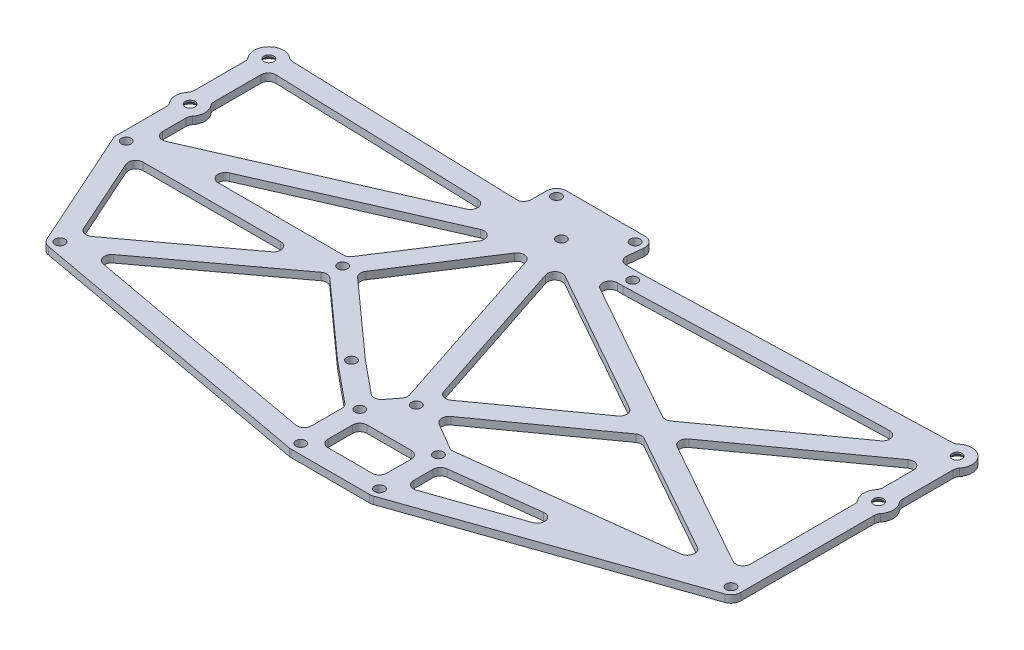
from build123d import *

# Parameters (mm, degrees)
SKETCH1_W               = 296
SKETCH1_H               = 146
SKETCH1_R               = 2
BOSS_EXTRUDE1_DEPTH     = 3
CHAMFER1_SIZE           = 2.3
SKETCH2_R               = 2
CUT_EXTRUDE2_DEPTH      = 3
SKETCH5_W               = 42
SKETCH5_H               = 8
SKETCH5_R               = 2
BOSS_EXTRUDE2_DEPTH     = 3
FILLET1_R               = 4
CUT_EXTRUDE3_DEPTH      = 334.677988486
CUT_EXTRUDE3_DEPTH_BACK = 334.677988486
SKETCH6_W               = 24
SKETCH6_H               = 16
FILLET2_START           = -1
FILLET2_DEPTH           = 5
FILLET2_2_DEPTH         = 3
FILLET3_R               = 3


with BuildPart() as part:
    # Sketch1 → Boss-Extrude1 (new body)
    with BuildSketch(Plane(origin=(0, 0, 0), x_dir=(1, 0, 0), z_dir=(0, 1, 0))):
        with Locations((-148, 73)):
            Rectangle(SKETCH1_W, SKETCH1_H)
        with Locations(Location((-288, 108, 0), (0, 0, 270))):
            Circle(SKETCH1_R, mode=Mode.SUBTRACT)
        with Locations(Location((-288, 140, 0), (0, 0, 270))):
            Circle(SKETCH1_R, mode=Mode.SUBTRACT)
        with Locations(Location((-8, 140, 0), (0, 0, 90))):
            Circle(SKETCH1_R, mode=Mode.SUBTRACT)
        with Locations(Location((-8, 108, 0), (0, 0, 90))):
            Circle(SKETCH1_R, mode=Mode.SUBTRACT)
    extrude(amount=BOSS_EXTRUDE1_DEPTH)

    # Chamfer1
    chamfer1_edges = [part.edges().sort_by_distance(p)[0] for p in [
        (-288, 0, -110),
        (-288, 0, -142),
        (-8, 0, -138),
        (-8, 0, -106),
    ]]
    chamfer(chamfer1_edges, length=CHAMFER1_SIZE)

    # Sketch2 → Cut-Extrude2 (cut)
    with BuildSketch(Plane(origin=(0, 3, 0), x_dir=(1, 0, 0), z_dir=(0, 1, 0))):
        with Locations(Location((-136, 136, 0), (0, 0, 270))):
            Circle(SKETCH2_R)
        with Locations(Location((-136, 48, 0), (0, 0, 270))):
            Circle(SKETCH2_R)
        with Locations(Location((-8, 48, 0), (0, 0, 270))):
            Circle(SKETCH2_R)
        with Locations(Location((-165, 136, 0), (0, 0, 270))):
            Circle(SKETCH2_R)
        with Locations(Location((-165, 50.61, 0), (0, 0, 270))):
            Circle(SKETCH2_R)
        with Locations(Location((-146, 35, 0), (0, 0, 270))):
            Circle(SKETCH2_R)
        with Locations(Location((-114, 35, 0), (0, 0, 270))):
            Circle(SKETCH2_R)
        with Locations(Location((-146, 11, 0), (0, 0, 270))):
            Circle(SKETCH2_R)
        with Locations(Location((-114, 11, 0), (0, 0, 270))):
            Circle(SKETCH2_R)
        with Locations(Location((-288, 82, 0), (0, 0, 270))):
            Circle(SKETCH2_R)
        with Locations(Location((-200, 82, 0), (0, 0, 270))):
            Circle(SKETCH2_R)
        with Locations(Location((-266, 33, 0), (0, 0, 270))):
            Circle(SKETCH2_R)
    extrude(amount=-CUT_EXTRUDE2_DEPTH, mode=Mode.SUBTRACT)

    # Sketch5 → Boss-Extrude2 (add, through all)
    with BuildSketch(Plane.XZ):
        with Locations((-165, -150)):
            Rectangle(SKETCH5_W, SKETCH5_H)
        with Locations(Location((-181, -150, 0), (0, 0, 270))):
            Circle(SKETCH5_R, mode=Mode.SUBTRACT)
        with Locations(Location((-149, -150, 0), (0, 0, 270))):
            Circle(SKETCH5_R, mode=Mode.SUBTRACT)
    extrude(amount=-BOSS_EXTRUDE2_DEPTH)

    # Fillet1
    fillet1_edges = [part.edges().sort_by_distance(p)[0] for p in [
        (-144, 1.5, -146),
        (-186, 1.5, -146),
    ]]
    fillet(fillet1_edges, radius=FILLET1_R)
    fillet1_2_edges = [part.edges().sort_by_distance(p)[0] for p in [
        (-144, 1.5, -154),
        (-186, 1.5, -154),
    ]]
    fillet(fillet1_2_edges, radius=FILLET1_R - 0.0001)  # a hair under: the kernel refuses the full size

    # Sketch6 → Cut-Extrude3 (cut, two sides: drawn at the far end of the back side and taken through both)
    with BuildSketch(Plane.XZ.offset(-CUT_EXTRUDE3_DEPTH_BACK)):
        Polygon((-133.907397883, -54.430072896), (-157.980712263, -127.480130325), (-87.351767692, -87.891932095), align=None)
        Polygon((-20.986134941, -135.592230635), (-80.182789638, -93.044635071), (-149.682702068, -132), (-136, -132), (-135.937515251, -132), (-135.875061066, -132.001951693), align=None)
        Polygon((-150, -15.8), (-256.225795533, -35.274729181), (-200.238623302, -76.840963111), (-167.67068416, -47.632174264), (-167.606181941, -47.574324988), (-167.539235065, -47.519322843), (-150, -33.109456561), align=None)
        Polygon((-194.783240599, -82.69435997), (-166.185335484, -126.816842148), (-140.462014687, -48.759868694), (-146.652169254, -40.712667757), (-162.393818059, -53.645675012), align=None)
        Polygon((-202.174118679, -86), (-268.938394143, -86), (-175.620145484, -126.968987217), align=None)
        with BuildLine():
            Line((-182.751496726, -132.575169862), (-284, -88.124607449))
            Line((-284, -88.124607449), (-284, -103.527864045))
            ThreePointArc((-284, -103.527864045), (-282.522774425, -105.550510257), (-282, -108))
            ThreePointArc((-282, -108), (-282.522774425, -110.449489743), (-284, -112.472135955))
            Line((-284, -112.472135955), (-284, -135.527864045))
            ThreePointArc((-284, -135.527864045), (-283.826878454, -135.68896108), (-283.660239543, -135.856754994))
            Line((-283.660239543, -135.856754994), (-182.751496726, -132.575169862))
        make_face()
        Polygon((-264.389069086, -39.177871329), (-281.819412571, -78), (-212.098038631, -78), align=None)
        with BuildLine():
            Line((-292, -103.527864045), (-292, -82))
            ThreePointArc((-292, -82), (-291.911285756, -81.162238858), (-291.649078134, -80.361638389))
            Line((-291.649078134, -80.361638389), (-269.649078134, -31.361638389))
            ThreePointArc((-269.649078134, -31.361638389), (-268.468411335, -29.852469939), (-266.721311475, -29.06557377))
            Line((-266.721311475, -29.06557377), (-146.721311475, -7.06557377))
            ThreePointArc((-146.721311475, -7.06557377), (-146.362142984, -7.016427174), (-146, -7))
            Line((-146, -7), (-114, -7))
            ThreePointArc((-114, -7), (-113.331483701, -7.056259902), (-112.681772734, -7.223457021))
            Line((-112.681772734, -7.223457021), (-6.681772734, -44.223457021))
            ThreePointArc((-6.681772734, -44.223457021), (-4.738642226, -45.684067042), (-4, -48))
            Line((-4, -48), (-4, -103.527864045))
            ThreePointArc((-4, -103.527864045), (-2.522774425, -105.550510257), (-2, -108))
            ThreePointArc((-2, -108), (-2.522774425, -110.449489743), (-4, -112.472135955))
            Line((-4, -112.472135955), (-4, -135.527864045))
            ThreePointArc((-4, -135.527864045), (-2.522774425, -137.550510257), (-2, -140))
            ThreePointArc((-2, -140), (-3.757359379, -144.242640754), (-8.000000188, -146))
            Line((-8.000000188, -146), (0, -146))
            Line((0, -146), (0, 0))
            Line((0, 0), (-296, 0))
            Line((-296, 0), (-296, -146))
            Line((-296, -146), (-288, -146))
            ThreePointArc((-288, -146), (-293.605034154, -142.140932539), (-292, -135.527864045))
            Line((-292, -135.527864045), (-292, -112.472135955))
            ThreePointArc((-292, -112.472135955), (-294, -108), (-292, -103.527864045))
        make_face()
        with Locations((-130, -23)):
            Rectangle(SKETCH6_W, SKETCH6_H)
        Polygon((-44.511030961, -39.492262445), (-110, -16.632905327), (-110, -31.46059643), align=None)
        Polygon((-128.691096176, -48.3272595), (-79.650414034, -83.575249789), (-20.61135626, -50.48329384), (-113.136448618, -39.135876852), align=None)
        with BuildLine():
            Line((-12, -54.827530051), (-72.48143598, -88.727952766))
            Line((-72.48143598, -88.727952766), (-12, -132.198984876))
            Line((-12, -132.198984876), (-12, -112.472135955))
            ThreePointArc((-12, -112.472135955), (-14, -108), (-12, -103.527864045))
            Line((-12, -103.527864045), (-12, -54.827530051))
        make_face()
        with BuildLine():
            ThreePointArc((-145, -150), (-146.171572875, -152.828427125), (-149, -154))
            Line((-149, -154), (-148, -154))
            ThreePointArc((-148, -154), (-145.171572875, -152.828427125), (-144, -150))
            ThreePointArc((-144, -150), (-142.828427125, -147.171572875), (-140, -146))
            Line((-140, -146), (-8.000000188, -146))
            ThreePointArc((-8.000000188, -146), (-10.534741347, -145.438298107), (-12.594892902, -143.858362245))
            Line((-12.594892902, -143.858362245), (-136.062484749, -140))
            Line((-136.062484749, -140), (-146.048534903, -140))
            Line((-146.048534903, -140), (-145.022763384, -149.573867505))
            ThreePointArc((-145.022763384, -149.573867505), (-145.0056949, -149.786629972), (-145, -150))
        make_face()
        with BuildLine():
            Line((-185, -140.652521088), (-283.400214403, -143.852528061))
            ThreePointArc((-283.400214403, -143.852528061), (-285.461808554, -145.436688715), (-288, -146))
            Line((-288, -146), (-190, -146))
            ThreePointArc((-190, -146), (-187.171572875, -147.171572875), (-186, -150))
            ThreePointArc((-186, -150), (-184.828427125, -152.828427125), (-182, -154))
            Line((-182, -154), (-181, -154))
            ThreePointArc((-181, -154), (-183.828427125, -152.828427125), (-185, -150))
            Line((-185, -150), (-185, -140.652521088))
        make_face()
    extrude(amount=CUT_EXTRUDE3_DEPTH + CUT_EXTRUDE3_DEPTH_BACK, mode=Mode.SUBTRACT)


with BuildPart() as cut_extrude3_kept_piece:
    # of the separate pieces the step leaves, the one the design keeps (cut_extrude3_pieces_kept)
    add(part.part.solids().sort_by_distance((-292, 3, -112.472135955))[0])

    # Fillet2: read off the stored shape, not the designer's step
    # Fillet2 outline → Fillet2 (cut)
    with BuildSketch(Plane(origin=(0, 0, 0), x_dir=(1, 0, 0), z_dir=(0, 1, 0)).offset(FILLET2_START)):
        with BuildLine():
            ThreePointArc((-135.890674556, 132.001463772), (-135.937520968, 132.000365965), (-135.984378813, 132))
            Line((-135.984378813, 132), (-135.937515251, 132))
            Line((-135.937515251, 132), (-135.890674556, 132.001463772))
        make_face()
        with BuildLine():
            Line((-167.606181941, 47.574324988), (-167.555971882, 47.533073461))
            ThreePointArc((-167.555971882, 47.533073461), (-167.605723551, 47.574858919), (-167.654558656, 47.61771199))
            Line((-167.654558656, 47.61771199), (-167.606181941, 47.574324988))
        make_face()
    extrude(amount=FILLET2_DEPTH, mode=Mode.SUBTRACT)

    # Fillet2 2 outline → Fillet2 2 (add)
    with BuildSketch(Plane(origin=(0, 0, 0), x_dir=(1, 0, 0), z_dir=(0, 1, 0))):
        with BuildLine():
            Line((-284, 135.527864045), (-284, 134.469986963))
            ThreePointArc((-284, 134.469986963), (-283.913822114, 135.183878191), (-283.660239543, 135.856754994))
            ThreePointArc((-283.660239543, 135.856754994), (-283.826878454, 135.68896108), (-284, 135.527864045))
        make_face()
        with BuildLine():
            ThreePointArc((-283.333333333, 111.771236166), (-283.828427125, 112.656854249), (-284, 113.656854249))
            Line((-284, 113.656854249), (-284, 112.472135955))
            ThreePointArc((-284, 112.472135955), (-283.652518786, 112.135142935), (-283.333333333, 111.771236166))
        make_face()
        with BuildLine():
            Line((-182.751496726, 132.575169862), (-195.967609843, 133.004962159))
            ThreePointArc((-195.967609843, 133.004962159), (-193.119441456, 130.574862501), (-194.859149084, 127.259615168))
            Line((-194.859149084, 127.259615168), (-182.751496726, 132.575169862))
        make_face()
        with BuildLine():
            ThreePointArc((-284, 102.343145751), (-283.828427125, 103.343145751), (-283.333333333, 104.228763834))
            ThreePointArc((-283.333333333, 104.228763834), (-283.652518786, 103.864857065), (-284, 103.527864045))
            Line((-284, 103.527864045), (-284, 102.343145751))
        make_face()
        with BuildLine():
            Line((-284, 88.124607449), (-279.794029814, 89.971130946))
            ThreePointArc((-279.794029814, 89.971130946), (-282.640440405, 90.206299656), (-284, 92.718063036))
            Line((-284, 92.718063036), (-284, 88.124607449))
        make_face()
        with BuildLine():
            Line((-4, 135.527864045), (-4, 134.343145751))
            ThreePointArc((-4, 134.343145751), (-3.828427125, 135.343145751), (-3.333333333, 136.228763834))
            ThreePointArc((-3.333333333, 136.228763834), (-3.652518786, 135.864857065), (-4, 135.527864045))
        make_face()
        with BuildLine():
            ThreePointArc((-4, 102.343145751), (-3.828427125, 103.343145751), (-3.333333333, 104.228763834))
            ThreePointArc((-3.333333333, 104.228763834), (-3.652518786, 103.864857065), (-4, 103.527864045))
            Line((-4, 103.527864045), (-4, 102.343145751))
        make_face()
        with BuildLine():
            ThreePointArc((-3.333333333, 111.771236166), (-3.828427125, 112.656854249), (-4, 113.656854249))
            Line((-4, 113.656854249), (-4, 112.472135955))
            ThreePointArc((-4, 112.472135955), (-3.652518786, 112.135142935), (-3.333333333, 111.771236166))
        make_face()
        with BuildLine():
            Line((-146.048534903, 140), (-142.70993608, 140))
            ThreePointArc((-142.70993608, 140), (-144.941392792, 140.994856378), (-145.692863542, 143.319599371))
            Line((-145.692863542, 143.319599371), (-146.048534903, 140))
        make_face()
        with BuildLine():
            Line((-136.062484749, 140), (-136.015644053, 140.001463772))
            ThreePointArc((-136.015644053, 140.001463772), (-136.062490465, 140.000365965), (-136.10934831, 140))
            Line((-136.10934831, 140), (-136.062484749, 140))
        make_face()
        with BuildLine():
            ThreePointArc((-12.594892902, 143.858362245), (-12.268917799, 144.216199808), (-11.915158267, 144.54659606))
            ThreePointArc((-11.915158267, 144.54659606), (-12.784880105, 144.024081776), (-13.779033145, 143.821357863))
            Line((-13.779033145, 143.821357863), (-12.594892902, 143.858362245))
        make_face()
        with BuildLine():
            ThreePointArc((-292, 103.527864045), (-292.347481214, 103.864857065), (-292.666666667, 104.228763834))
            ThreePointArc((-292.666666667, 104.228763834), (-292.171572875, 103.343145751), (-292, 102.343145751))
            Line((-292, 102.343145751), (-292, 103.527864045))
        make_face()
        with BuildLine():
            ThreePointArc((-185, 143.751668002), (-185.913439227, 141.596148542), (-188.097509428, 140.753253102))
            Line((-188.097509428, 140.753253102), (-185, 140.652521088))
            Line((-185, 140.652521088), (-185, 143.751668002))
        make_face()
        with BuildLine():
            ThreePointArc((-282.216122074, 143.814020993), (-283.21001705, 144.018006357), (-284.079075097, 144.541623929))
            ThreePointArc((-284.079075097, 144.541623929), (-283.725735135, 144.210779009), (-283.400214403, 143.852528061))
            Line((-283.400214403, 143.852528061), (-282.216122074, 143.814020993))
        make_face()
        with BuildLine():
            ThreePointArc((-292.666666667, 136.228763834), (-292.171572875, 135.343145751), (-292, 134.343145751))
            Line((-292, 134.343145751), (-292, 135.527864045))
            ThreePointArc((-292, 135.527864045), (-292.347481214, 135.864857065), (-292.666666667, 136.228763834))
        make_face()
        with BuildLine():
            ThreePointArc((-292, 113.656854249), (-292.171572875, 112.656854249), (-292.666666667, 111.771236166))
            ThreePointArc((-292.666666667, 111.771236166), (-292.347481214, 112.135142935), (-292, 112.472135955))
            Line((-292, 112.472135955), (-292, 113.656854249))
        make_face()
        with BuildLine():
            ThreePointArc((-16.750908144, 128.784269647), (-13.631191107, 129.017748251), (-12, 126.348223533))
            Line((-12, 126.348223533), (-12, 132.198984876))
            Line((-12, 132.198984876), (-16.750908144, 128.784269647))
        make_face()
        with BuildLine():
            Line((-12, 112.472135955), (-12, 113.656854249))
            ThreePointArc((-12, 113.656854249), (-12.171572875, 112.656854249), (-12.666666667, 111.771236166))
            ThreePointArc((-12.666666667, 111.771236166), (-12.347481214, 112.135142935), (-12, 112.472135955))
        make_face()
        with BuildLine():
            ThreePointArc((-68.371886716, 86.42451114), (-69.900331644, 88.873064295), (-68.655969732, 91.477506631))
            Line((-68.655969732, 91.477506631), (-72.48143598, 88.727952766))
            Line((-72.48143598, 88.727952766), (-68.371886716, 86.42451114))
        make_face()
        with BuildLine():
            ThreePointArc((-12, 103.527864045), (-12.347481214, 103.864857065), (-12.666666667, 104.228763834))
            ThreePointArc((-12.666666667, 104.228763834), (-12.171572875, 103.343145751), (-12, 102.343145751))
            Line((-12, 102.343145751), (-12, 103.527864045))
        make_face()
        with BuildLine():
            ThreePointArc((-12, 59.948177589), (-13.483503278, 57.359695854), (-16.466825129, 57.331228212))
            Line((-16.466825129, 57.331228212), (-12, 54.827530051))
            Line((-12, 54.827530051), (-12, 59.948177589))
        make_face()
        with BuildLine():
            ThreePointArc((-112.123596692, 39.260094541), (-113.101947814, 39.30111436), (-114.014973019, 39.655004907))
            Line((-114.014973019, 39.655004907), (-113.136448618, 39.135876852))
            Line((-113.136448618, 39.135876852), (-112.123596692, 39.260094541))
        make_face()
        with BuildLine():
            Line((-128.691096176, 48.3272595), (-124.735606244, 45.98992454))
            ThreePointArc((-124.735606244, 45.98992454), (-126.20641556, 48.438512207), (-124.960326452, 51.008750239))
            Line((-124.960326452, 51.008750239), (-128.691096176, 48.3272595))
        make_face()
        with BuildLine():
            ThreePointArc((-28.603048326, 54.962713597), (-27.126394954, 51.76616581), (-29.704685065, 49.368074269))
            Line((-29.704685065, 49.368074269), (-20.61135626, 50.48329384))
            Line((-20.61135626, 50.48329384), (-28.603048326, 54.962713597))
        make_face()
        with BuildLine():
            Line((-79.650414034, 83.575249789), (-81.201681326, 82.460276423))
            ThreePointArc((-81.201681326, 82.460276423), (-79.619169404, 83.019500365), (-77.983948053, 82.641179686))
            Line((-77.983948053, 82.641179686), (-79.650414034, 83.575249789))
        make_face()
        with BuildLine():
            ThreePointArc((-144.763424227, 43.168036292), (-146.801020583, 42.016528961), (-149.045722591, 42.679160788))
            Line((-149.045722591, 42.679160788), (-146.652169254, 40.712667757))
            Line((-146.652169254, 40.712667757), (-144.763424227, 43.168036292))
        make_face()
        with BuildLine():
            Line((-162.393818059, 53.645675012), (-162.343608, 53.604423485))
            ThreePointArc((-162.343608, 53.604423485), (-162.393359669, 53.646208944), (-162.442194774, 53.689062014))
            Line((-162.442194774, 53.689062014), (-162.393818059, 53.645675012))
        make_face()
        with BuildLine():
            ThreePointArc((-140.959254575, 50.268734563), (-140.851103519, 48.82612944), (-141.430653735, 47.500637932))
            Line((-141.430653735, 47.500637932), (-140.462014687, 48.759868694))
            Line((-140.462014687, 48.759868694), (-140.959254575, 50.268734563))
        make_face()
        with BuildLine():
            Line((-194.783240599, 82.69435997), (-192.873684219, 80.981760691))
            ThreePointArc((-192.873684219, 80.981760691), (-193.844444881, 82.819315353), (-193.388130008, 84.846816311))
            Line((-193.388130008, 84.846816311), (-194.783240599, 82.69435997))
        make_face()
        with BuildLine():
            ThreePointArc((-169.591796057, 121.561160121), (-166.690291819, 122.904790418), (-164.225065971, 120.868438107))
            Line((-164.225065971, 120.868438107), (-166.185335484, 126.816842148))
            Line((-166.185335484, 126.816842148), (-169.591796057, 121.561160121))
        make_face()
        with BuildLine():
            ThreePointArc((-184.791224782, 122.94265972), (-181.299849689, 122.139158721), (-181.067795637, 118.564041266))
            Line((-181.067795637, 118.564041266), (-175.620145484, 126.968987217))
            Line((-175.620145484, 126.968987217), (-184.791224782, 122.94265972))
        make_face()
        with BuildLine():
            Line((-202.174118679, 86), (-201.287248729, 87.368313637))
            ThreePointArc((-201.287248729, 87.368313637), (-202.372063122, 86.364183325), (-203.804707689, 86))
            Line((-203.804707689, 86), (-202.174118679, 86))
        make_face()
        with BuildLine():
            ThreePointArc((-254.642189751, 86), (-257.578241204, 88.383881615), (-255.848159937, 91.746932091))
            Line((-255.848159937, 91.746932091), (-268.938394143, 86))
            Line((-268.938394143, 86), (-254.642189751, 86))
        make_face()
        with BuildLine():
            ThreePointArc((-139.661553747, 126.383050623), (-141.097386722, 129.758007872), (-138.194728619, 132))
            Line((-138.194728619, 132), (-149.682702068, 132))
            Line((-149.682702068, 132), (-139.661553747, 126.383050623))
        make_face()
        with BuildLine():
            ThreePointArc((-78.631522346, 94.159608438), (-80.214034268, 93.600384495), (-81.849255619, 93.978705175))
            Line((-81.849255619, 93.978705175), (-80.182789638, 93.044635071))
            Line((-80.182789638, 93.044635071), (-78.631522346, 94.159608438))
        make_face()
        with BuildLine():
            Line((-20.986134941, 135.592230635), (-30.819440405, 135.284939839))
            ThreePointArc((-30.819440405, 135.284939839), (-27.884917165, 133.250637768), (-28.974828003, 129.850357497))
            Line((-28.974828003, 129.850357497), (-20.986134941, 135.592230635))
        make_face()
        with BuildLine():
            ThreePointArc((-139, 15), (-141.121320344, 15.878679656), (-142, 18))
            Line((-142, 18), (-142, 15))
            Line((-142, 15), (-139, 15))
        make_face()
        with BuildLine():
            Line((-142, 31), (-142, 28))
            ThreePointArc((-142, 28), (-141.121320344, 30.121320344), (-139, 31))
            Line((-139, 31), (-142, 31))
        make_face()
        with BuildLine():
            ThreePointArc((-118, 18), (-118.878679656, 15.878679656), (-121, 15))
            Line((-121, 15), (-118, 15))
            Line((-118, 15), (-118, 18))
        make_face()
        with BuildLine():
            Line((-118, 31), (-121, 31))
            ThreePointArc((-121, 31), (-118.878679656, 30.121320344), (-118, 28))
            Line((-118, 28), (-118, 31))
        make_face()
        with BuildLine():
            Line((-212.098038631, 78), (-221.171567604, 78))
            ThreePointArc((-221.171567604, 78), (-218.323217923, 75.941755856), (-219.38326761, 72.591269395))
            Line((-219.38326761, 72.591269395), (-212.098038631, 78))
        make_face()
        with BuildLine():
            ThreePointArc((-279.9207806, 73.771228791), (-279.702534449, 76.629982573), (-277.183971999, 78))
            Line((-277.183971999, 78), (-281.819412571, 78))
            Line((-281.819412571, 78), (-279.9207806, 73.771228791))
        make_face()
        with BuildLine():
            Line((-264.389069086, 39.177871329), (-261.392570905, 41.402544221))
            ThreePointArc((-261.392570905, 41.402544221), (-263.937834035, 40.908344098), (-265.917679501, 42.582503617))
            Line((-265.917679501, 42.582503617), (-264.389069086, 39.177871329))
        make_face()
        with BuildLine():
            ThreePointArc((-155.565517586, 120.151263721), (-154.623841763, 123.405628717), (-151.249421331, 123.707177447))
            Line((-151.249421331, 123.707177447), (-157.980712263, 127.480130325))
            Line((-157.980712263, 127.480130325), (-155.565517586, 120.151263721))
        make_face()
        with BuildLine():
            Line((-87.351767692, 87.891932095), (-91.461316956, 90.19537372))
            ThreePointArc((-91.461316956, 90.19537372), (-89.932872028, 87.746820565), (-91.17723394, 85.142378229))
            Line((-91.17723394, 85.142378229), (-87.351767692, 87.891932095))
        make_face()
        with BuildLine():
            ThreePointArc((-130.58703815, 56.816581454), (-133.266339402, 56.399894451), (-135.187217421, 58.313663219))
            Line((-135.187217421, 58.313663219), (-133.907397883, 54.430072896))
            Line((-133.907397883, 54.430072896), (-130.58703815, 56.816581454))
        make_face()
        with BuildLine():
            Line((-150, 33.109456561), (-151.095573603, 34.009556769))
            ThreePointArc((-151.095573603, 34.009556769), (-150.287687408, 32.973485176), (-150, 31.691548982))
            Line((-150, 31.691548982), (-150, 33.109456561))
        make_face()
        with BuildLine():
            ThreePointArc((-202.205890773, 75.380416049), (-200.278978594, 75.96848151), (-198.414577607, 75.205054701))
            Line((-198.414577607, 75.205054701), (-200.238623302, 76.840963111))
            Line((-200.238623302, 76.840963111), (-202.205890773, 75.380416049))
        make_face()
        with BuildLine():
            Line((-150, 15.8), (-150, 19.4))
            ThreePointArc((-150, 19.4), (-151.079446801, 17.095336161), (-153.540983607, 16.449180328))
            Line((-153.540983607, 16.449180328), (-150, 15.8))
        make_face()
        with BuildLine():
            ThreePointArc((-249.43612579, 34.029956395), (-251.81705685, 36.300765271), (-250.683442178, 39.389506672))
            Line((-250.683442178, 39.389506672), (-256.225795533, 35.274729181))
            Line((-256.225795533, 35.274729181), (-249.43612579, 34.029956395))
        make_face()
        with BuildLine():
            Line((-110, 16.632905327), (-106.01132955, 18.025177088))
            ThreePointArc((-106.01132955, 18.025177088), (-108.736949719, 18.411565991), (-110, 20.857584322))
            Line((-110, 20.857584322), (-110, 16.632905327))
        make_face()
        with BuildLine():
            ThreePointArc((-72.259492571, 36.089149228), (-68.972576987, 33.792275117), (-70.905633731, 30.279052043))
            Line((-70.905633731, 30.279052043), (-44.511030961, 39.492262445))
            Line((-44.511030961, 39.492262445), (-72.259492571, 36.089149228))
        make_face()
        with BuildLine():
            Line((-110, 31.46059643), (-110, 28.806043753))
            ThreePointArc((-110, 28.806043753), (-109.246727083, 30.794062217), (-107.36518839, 31.783733703))
            Line((-107.36518839, 31.783733703), (-110, 31.46059643))
        make_face()
    extrude(amount=FILLET2_2_DEPTH)

    # Fillet3
    # the kernel refuses this fillet: 3 mm, written as the material it adds along each edge
    with BuildSketch(Plane(origin=(-283.660239543, 0, -135.856754994), x_dir=(0.9994716332766347, 0, 0.032503142545549375), z_dir=(0, 1, 0))) as fillet3_piece_1:
        with BuildLine():
            CenterArc((2.759206844, -3), FILLET3_R, 90, 91.862620949)
            Line((-0.239208056, -3.097509428), (-0.539049546, -3.10726037))
            ThreePointArc((-0.539049546, -3.10726037), (-0.59434811, -1.406829535), (-0.270390828, 0.129956916))
            Line((-0.270390828, 0.129956916), (0, 0.3))
            Line((0, 0.3), (2.759206844, 0.3))
            Line((2.759206844, 0.3), (2.759206844, 0))
        make_face()
    extrude(amount=3)


solid = cut_extrude3_kept_piece.part
